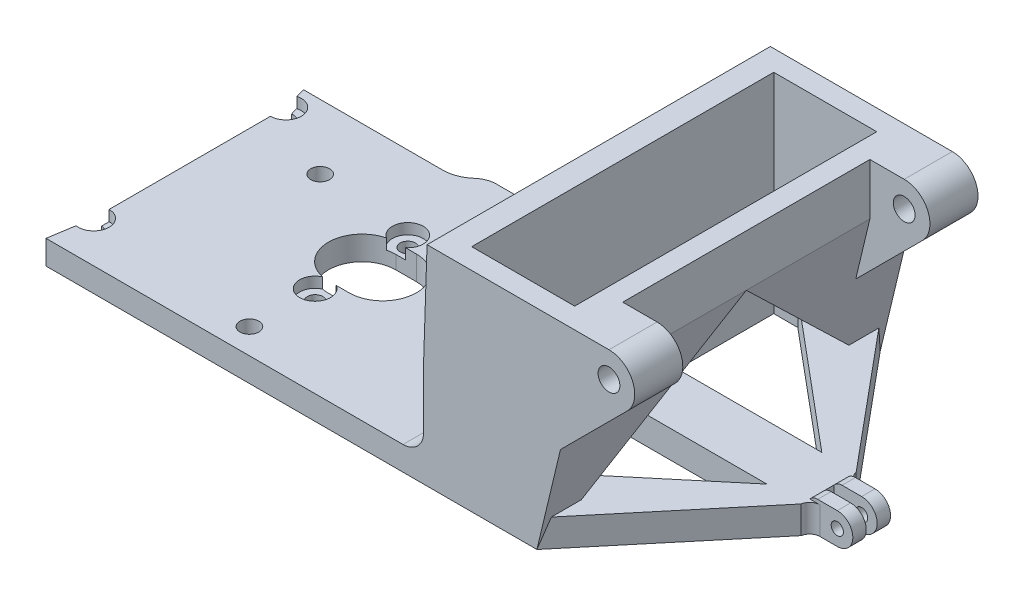
from build123d import *
from build123d.topology import SkipClean

# Parameters (mm, degrees)
SKETCH1_W                                        = 115
SKETCH1_H                                        = 100
EXTRUDE1_DEPTH                                   = 7
SKETCH2_R                                        = 2.75
SKETCH2_R_2                                      = 2.25
EXTRUDE7_DEPTH                                   = 7
CBORE_FOR_M4_PAN_HEAD_MACHINE_SCREW2_D           = 4.5
CBORE_FOR_M4_PAN_HEAD_MACHINE_SCREW2_CBORE_D     = 9
CBORE_FOR_M4_PAN_HEAD_MACHINE_SCREW2_CBORE_DEPTH = 3.1
EXTRUDE9_DEPTH                                   = 101.244700608
FILLET1_R                                        = 10
SKETCH19_W                                       = 100
SKETCH19_H                                       = 60.9
BOSS_EXTRUDE1_DEPTH                              = 8
BOSS_EXTRUDE2_DEPTH                              = 6
BOSS_EXTRUDE3_DEPTH                              = 6
SKETCH22_W                                       = 6
SKETCH22_H                                       = 15
BOSS_EXTRUDE4_DEPTH                              = 88
BOSS_EXTRUDE5_DEPTH                              = 5.834785
SKETCH25_R                                       = 3.175
BOSS_EXTRUDE6_DEPTH                              = 14
BOSS_EXTRUDE7_START                              = -14
SKETCH26_R                                       = 3.175
BOSS_EXTRUDE7_DEPTH                              = 14
FILLET2_R                                        = 6
BOSS_EXTRUDE8_DEPTH                              = 4
BOSS_EXTRUDE9_DEPTH                              = 4
BOSS_EXTRUDE10_DEPTH                             = 5.5
CUT_EXTRUDE1_DEPTH                               = 1.6
FILLET3_R                                        = 3
SKETCH30_W                                       = 10.22
SKETCH30_H                                       = 12.04
SKETCH30_W_2                                     = 11
SKETCH30_H_2                                     = 9
CUT_EXTRUDE2_DEPTH                               = 182.875481855
CUT_EXTRUDE3_REACH                               = 200.692


with BuildPart() as part:
    # Sketch1 → Extrude1 (new body)
    with BuildSketch(Plane(origin=(0, 0, 0), x_dir=(1, 0, 0), z_dir=(0, 1, 0))):
        with Locations((22.5, 10)):
            Rectangle(SKETCH1_W, SKETCH1_H)
    extrude(amount=EXTRUDE1_DEPTH)

    # Sketch2 → Extrude7 (cut)
    with BuildSketch(Plane(origin=(0, 0, 0), x_dir=(1, 0, 0), z_dir=(0, 1, 0))):
        with Locations(Location((-6.254781434, 16.117525773, 0), (0, 0, 270))):
            Circle(SKETCH2_R)
        with Locations(Location((50.036869812, 16.117525773, 0), (0, 0, 270))):
            Circle(SKETCH2_R)
        with Locations(Location((-28.108955811, -28, 0), (0, 0, 270))):
            Circle(SKETCH2_R_2)
        with Locations(Location((-28.108955811, 28, 0), (0, 0, 270))):
            Circle(SKETCH2_R_2)
        with Locations(Location((21.891044189, -32.632474227, 0), (0, 0, 270))):
            Circle(SKETCH2_R)
        with Locations(Location((21.891044189, -13.5, 0), (0, 0, 270))):
            Circle(SKETCH2_R_2)
        with Locations(Location((21.891044189, 13.5, 0), (0, 0, 270))):
            Circle(SKETCH2_R_2)
        with BuildLine():
            Line((21.891044189, 10), (27.891044189, 10))
            ThreePointArc((27.891044189, 10), (37.689325953, 0.201718236), (27.891044189, -9.596563528))
            Line((27.891044189, -9.596563528), (21.891044189, -9.596563528))
            ThreePointArc((21.891044189, -9.596563528), (12.092762425, 0.201718236), (21.891044189, 10))
        make_face()
    extrude(amount=EXTRUDE7_DEPTH, mode=Mode.SUBTRACT)

    # CBORE for M4 Pan Head Machine Screw2 (through all)
    with Locations(Plane(origin=(-28.108955811, 7, -28), x_dir=(0, 0, 1), z_dir=(0, 1, 0))):
        with Locations((0, 0), (14.5, 50), (41.5, 50), (56, 0)):
            CounterBoreHole(CBORE_FOR_M4_PAN_HEAD_MACHINE_SCREW2_D / 2, CBORE_FOR_M4_PAN_HEAD_MACHINE_SCREW2_CBORE_D / 2, CBORE_FOR_M4_PAN_HEAD_MACHINE_SCREW2_CBORE_DEPTH)

    # Sketch18 → Extrude9 (cut, through all)
    with BuildSketch(Plane(origin=(0, 7, 0), x_dir=(1, 0, 0), z_dir=(0, 1, 0))):
        with BuildLine():
            Line((21.891044189, 39.300103485), (30, 39.300103485))
            ThreePointArc((30, 39.300103485), (33.535533906, 40.764569579), (35, 44.300103485))
            Line((35, 44.300103485), (35, 60))
            Line((35, 60), (-35, 60))
            Line((-35, 60), (-35, 35))
            Line((-35, 35), (-35, -40))
            Line((-35, -40), (-30, -40))
            Line((-30, -40), (-28.108955811, -28))
            Line((-28.108955811, -28), (-28.108955811, 28))
            Line((-28.108955811, 28), (-30, 35))
            Line((-30, 35), (15.43267297, 35))
            ThreePointArc((15.43267297, 35), (18.01156456, 38.126735256), (21.891044189, 39.300103485))
        make_face()
    extrude(amount=-EXTRUDE9_DEPTH, mode=Mode.SUBTRACT)

    # Fillet1
    fillet1_edges = [part.edges().sort_by_distance(p)[0] for p in [
        (15.43267297, 3.5, -35),
        (35, 3.5, -60),
    ]]
    fillet(fillet1_edges, radius=FILLET1_R)

    # Sketch19 → Boss-Extrude1 (add)
    with BuildSketch(Plane(origin=(80, 0, 0), x_dir=(0, 0, -1), z_dir=(1, 0, 0))):
        with Locations((10, 30.45)):
            Rectangle(SKETCH19_W, SKETCH19_H)
    extrude(amount=BOSS_EXTRUDE1_DEPTH)

    # Sketch20 → Boss-Extrude2 (add)
    with BuildSketch(Plane(origin=(0, 0, -60), x_dir=(-1, 0, 0), z_dir=(0, 0, -1))):
        Polygon((-88, 0), (-113, 0), (-124, 45.9), (-124, 60.9), (-88, 60.9), (-80, 60.9), (-80, 7), (-45, 7), (-45, 0), align=None)
    extrude(amount=-BOSS_EXTRUDE2_DEPTH)

    # Sketch21 → Boss-Extrude3 (add)
    with BuildSketch(Plane.XY.offset(40)):
        Polygon((88, 60.9), (88, 0), (113, 0), (124, 45.9), (124, 60.9), align=None)
    extrude(amount=-BOSS_EXTRUDE3_DEPTH)

    # Sketch22 → Boss-Extrude4 (add)
    with BuildSketch(Plane.XY.offset(-54)):
        with Locations((121, 53.4)):
            Rectangle(SKETCH22_W, SKETCH22_H)
    extrude(amount=BOSS_EXTRUDE4_DEPTH)

    # Sketch23 → Boss-Extrude5 (add)
    with BuildSketch(Plane(origin=(106.862582536, -25.609769235, 0), x_dir=(0, 0, -1), z_dir=(0.9724641747215814, -0.2330524165999433, 0))):
        Polygon((10, 73.534605278), (54, 29.534605278), (54, 73.534605278), align=None)
        Polygon((-34, 29.534605278), (10, 73.534605278), (-34, 73.534605278), align=None)
    extrude(amount=-BOSS_EXTRUDE5_DEPTH)

    # Sketch25 → Boss-Extrude6 (add)
    # profile 1 of 2: a face of its own
    with BuildSketch(Plane(origin=(0, 0, -60), x_dir=(-1, 0, 0), z_dir=(0, 0, -1))):
        with BuildLine():
            Line((-124, 60.9), (-134, 60.9))
            ThreePointArc((-134, 60.9), (-141.5, 53.4), (-134, 45.9))
            Line((-134, 45.9), (-124, 45.9))
            Line((-124, 45.9), (-124, 60.9))
        make_face()
        with Locations((-134, 53.4)):
            Circle(SKETCH25_R, mode=Mode.SUBTRACT)
    # profile 2 of 2: a face of its own
    with BuildSketch(Plane(origin=(0, 0, -60), x_dir=(-1, 0, 0), z_dir=(0, 0, -1))):
        with BuildLine():
            Line((-119.868979401, 28.662377683), (-124, 45.9))
            Line((-124, 45.9), (-134, 45.9))
            ThreePointArc((-134, 45.9), (-136.870125743, 46.470903506), (-139.303300859, 48.096699141))
            Line((-139.303300859, 48.096699141), (-119.868979401, 28.662377683))
        make_face()
    extrude(amount=-BOSS_EXTRUDE6_DEPTH)

    # Sketch26 → Boss-Extrude7 (add)
    with BuildSketch(Plane.XY.offset(40).offset(BOSS_EXTRUDE7_START)):
        with BuildLine():
            Line((134, 60.9), (124, 60.9))
            Line((124, 60.9), (124, 45.9))
            Line((124, 45.9), (119.868979401, 28.662377683))
            Line((119.868979401, 28.662377683), (139.303300859, 48.096699141))
            ThreePointArc((139.303300859, 48.096699141), (140.929096494, 56.270125743), (134, 60.9))
        make_face()
        with Locations(Location((134, 53.4, 0), (0, 0, 180))):
            Circle(SKETCH26_R, mode=Mode.SUBTRACT)
    extrude(amount=BOSS_EXTRUDE7_DEPTH)

    # Fillet2
    fillet2_edges = [part.edges().sort_by_distance(p)[0] for p in [
        (80, 7, -10),
    ]]
    fillet(fillet2_edges, radius=FILLET2_R)

    # Sketch27 → Boss-Extrude8 (add)
    with BuildSketch(Plane.XZ):
        Polygon((95, 34), (138, -2), (148, -2), (113, 40), (113, 34), align=None)
        Polygon((138, -2), (88, -2), (88, -10), (148, -10), (148, -2), align=None)
        Polygon((148, -18), (138, -18), (95, -54), (113, -54), (113, -60), align=None)
        Polygon((148, -10), (88, -10), (88, -18), (138, -18), (148, -18), align=None)
    extrude(amount=-BOSS_EXTRUDE8_DEPTH)

    # Sketch28 → Boss-Extrude9 (add)
    with BuildSketch(Plane(origin=(0, 4, 0), x_dir=(1, 0, 0), z_dir=(0, 1, 0))):
        Polygon((113.958605664, 58.849673203), (113.958605664, 53.086420137), (110.038543918, 54), (95, 54), (138, 18), (88, 18), (88, 2), (138, 2), (95, -34), (110.038543918, -34), (113.958605664, -33.086420137), (113.958605664, -38.849673203), (148, 2), (148, 18), align=None)
    extrude(amount=BOSS_EXTRUDE9_DEPTH)

    # Sketch29 → Boss-Extrude10 (add, symmetric)
    with SkipClean():  # the faces are left unmerged after this step: merging them gives an invalid solid
        with BuildSketch(Plane.XY.offset(-10)):
            with BuildLine():
                ThreePointArc((160.53, 4.53), (159.203193719, 7.733193719), (156, 9.06))
                Line((156, 9.06), (156, 6.308))
                ThreePointArc((156, 6.308), (157.257235857, 5.787235857), (157.778, 4.53))
                ThreePointArc((157.778, 4.53), (157.257235857, 3.272764143), (156, 2.752))
                Line((156, 2.752), (156, 0))
                ThreePointArc((156, 0), (159.203193719, 1.326806281), (160.53, 4.53))
            make_face()
            with BuildLine():
                Line((156, 6.308), (156, 9.06))
                ThreePointArc((156, 9.06), (151.47, 4.53), (156, 0))
                Line((156, 0), (156, 2.752))
                ThreePointArc((156, 2.752), (154.222, 4.53), (156, 6.308))
            make_face()
            with BuildLine():
                Line((156, 9.06), (148, 9.06))
                Line((148, 9.06), (148, 0))
                Line((148, 0), (156, 0))
                ThreePointArc((156, 0), (151.47, 4.53), (156, 9.06))
            make_face()
        extrude(amount=BOSS_EXTRUDE10_DEPTH, both=True)

    # Sketch29<3> → Cut-Extrude1 (cut, symmetric)
    with BuildSketch(Plane.XY.offset(-10)):
        with BuildLine():
            Line((156, 9.06), (148, 9.06))
            Line((148, 9.06), (148, 0))
            Line((148, 0), (156, 0))
            ThreePointArc((156, 0), (151.47, 4.53), (156, 9.06))
        make_face()
        with BuildLine():
            ThreePointArc((160.53, 4.53), (159.203193719, 7.733193719), (156, 9.06))
            Line((156, 9.06), (156, 6.308))
            ThreePointArc((156, 6.308), (157.257235857, 5.787235857), (157.778, 4.53))
            ThreePointArc((157.778, 4.53), (157.257235857, 3.272764143), (156, 2.752))
            Line((156, 2.752), (156, 0))
            ThreePointArc((156, 0), (159.203193719, 1.326806281), (160.53, 4.53))
        make_face()
        with BuildLine():
            Line((156, 6.308), (156, 9.06))
            ThreePointArc((156, 9.06), (151.47, 4.53), (156, 0))
            Line((156, 0), (156, 2.752))
            ThreePointArc((156, 2.752), (154.222, 4.53), (156, 6.308))
        make_face()
    extrude(amount=CUT_EXTRUDE1_DEPTH, both=True, mode=Mode.SUBTRACT)

    # Fillet3
    # the kernel refuses this fillet: 3 mm, written as the material it adds along each edge
    with BuildSketch(Plane(origin=(148, 8, -15.5), x_dir=(0, 0, -1), z_dir=(0, -1, 0))) as fillet3_piece_1:
        with BuildLine():
            CenterArc((3, 2.958039892), FILLET3_R, 180, 80.405931773)
            Line((0, 2.958039892), (0, 0))
            Line((0, 0), (2.5, 0))
        make_face()
    extrude(amount=8)
    with BuildSketch(Plane(origin=(148, 8, -4.5), x_dir=(1, 0, 0), z_dir=(0, -1, 0))) as fillet3_piece_2:
        with BuildLine():
            CenterArc((2.958039892, 3), FILLET3_R, 189.594068227, 80.405931773)
            Line((0, 2.5), (0, 0))
            Line((0, 0), (2.958039892, 0))
        make_face()
    extrude(amount=8)
    # the kernel refuses this fillet: 3 mm, written as the material it takes off along each edge
    with BuildSketch(Plane(origin=(148, 9.06, -14.120795399), x_dir=(0, -1, 0), z_dir=(0, 0, 1))) as fillet3_2_piece_1:
        with BuildLine():
            CenterArc((3, 2.28831816), FILLET3_R, 180, 49.709248271)
            Line((0, 2.28831816), (0, 0))
            Line((0, 0), (1.06, 0))
        make_face()
    extrude(amount=15.341590798, mode=Mode.SUBTRACT)
    with BuildSketch(Plane(origin=(148, 9.06, -21.220795399), x_dir=(1, 0, 0), z_dir=(0, 0, 1))) as fillet3_2_piece_2:
        with BuildLine():
            CenterArc((2.28831816, -3), FILLET3_R, 90, 49.709248271)
            Line((0, -1.06), (0, 0))
            Line((0, 0), (2.28831816, 0))
        make_face()
    extrude(amount=15.341590798, mode=Mode.SUBTRACT)

    # Sketch30 → Cut-Extrude2 (cut, through all)
    with BuildSketch(Plane.XZ):
        with Locations((38.051069812, -28.322925773)):
            Rectangle(SKETCH30_W, SKETCH30_H)
        with Locations((37.661069812, -40.402925773)):
            Rectangle(SKETCH30_W_2, SKETCH30_H_2)
    extrude(amount=-CUT_EXTRUDE2_DEPTH, mode=Mode.SUBTRACT)

    # Sketch31 → Cut-Extrude3 (cut, up to next)
    with BuildSketch(Plane(origin=(0, 0, -60), x_dir=(-1, 0, 0), z_dir=(0, 0, -1)), mode=Mode.PRIVATE) as cut_extrude3_sk1:
        Polygon((-80, 60.9), (-81, 60.9), (-80, 30.9), align=None)
    cut_extrude3_tool1 = extrude(cut_extrude3_sk1.sketch, amount=-CUT_EXTRUDE3_REACH, mode=Mode.PRIVATE) & part.part
    add(cut_extrude3_tool1.solids().sort_by_distance((80.333333, 50.9, -60))[0], mode=Mode.SUBTRACT)


solid = part.part
